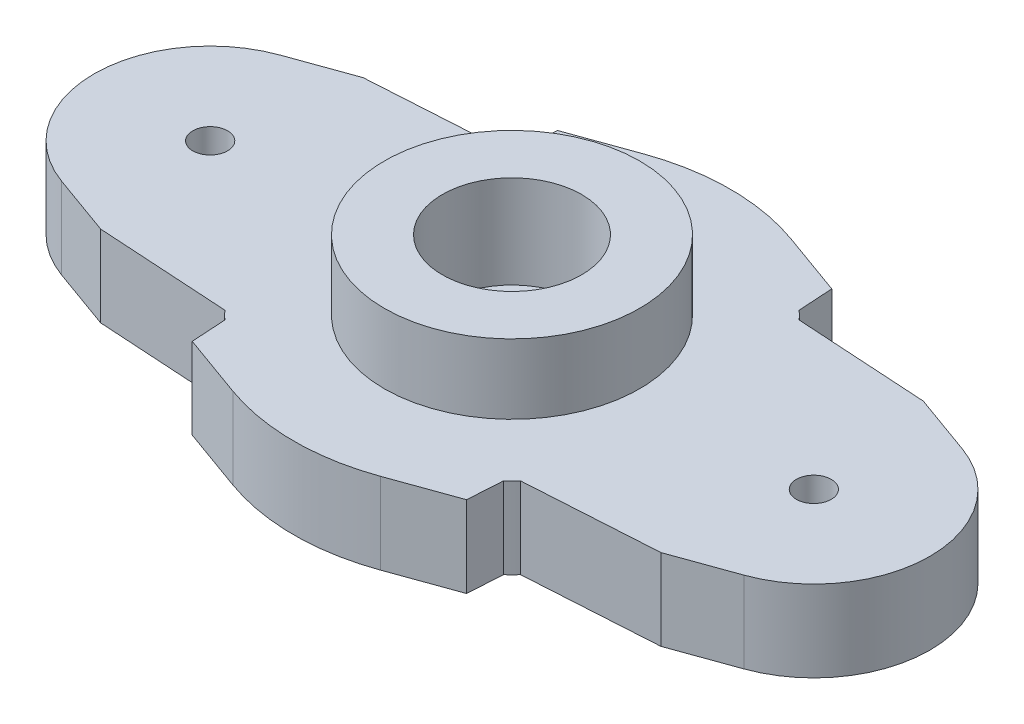
from build123d import *

# Parameters (mm, degrees)
SKETCH1_R           = 5.5
SKETCH1_R_2         = 3
BOSS_EXTRUDE1_DEPTH = 6.5
SKETCH2_R           = 3
BOSS_EXTRUDE2_DEPTH = 3.5
SKETCH4_R           = 3
SKETCH4_R_2         = 1.6
BOSS_EXTRUDE3_DEPTH = 2.5
SKETCH3_R           = 3.75
CUT_EXTRUDE2_DEPTH  = 2
CHAMFER1_SIZE2      = 2
CHAMFER1_SIZE       = 1
SKETCH5_R           = 0.75
CUT_EXTRUDE4_DEPTH  = 40.430318284
SKETCH6_OUTSIDE_W   = 72.61
SKETCH6_OUTSIDE_H   = 72.61
CUT_EXTRUDE5_DEPTH  = 40.430318284


with BuildPart() as part:
    # Sketch1 → Boss-Extrude1 (new body)
    with BuildSketch(Plane(origin=(0, 0, 0), x_dir=(1, 0, 0), z_dir=(0, 1, 0))):
        with Locations(Location((0, 0, 0), (0, 0, 90))):
            Circle(SKETCH1_R)
        with Locations(Location((0, 0, 0), (0, 0, 90))):
            Circle(SKETCH1_R_2, mode=Mode.SUBTRACT)
    extrude(amount=BOSS_EXTRUDE1_DEPTH)

    # Sketch2 → Boss-Extrude2 (add)
    with BuildSketch(Plane(origin=(0, 0, 0), x_dir=(1, 0, 0), z_dir=(0, 1, 0))):
        with BuildLine():
            Line((-6, 6.368869601), (-4.990599203, 22.806463037))
            ThreePointArc((-4.990599203, 22.806463037), (0, 27.5), (4.990599203, 22.806463037))
            Line((4.990599203, 22.806463037), (6, 6.368869601))
            ThreePointArc((6, 6.368869601), (6.187184335, 6.187184335), (6.368869601, 6))
            Line((6.368869601, 6), (22.806463037, 4.990599203))
            ThreePointArc((22.806463037, 4.990599203), (27.5, 0), (22.806463037, -4.990599203))
            Line((22.806463037, -4.990599203), (6.368869601, -6))
            ThreePointArc((6.368869601, -6), (6.187184335, -6.187184335), (6, -6.368869601))
            Line((6, -6.368869601), (4.990599203, -22.806463037))
            ThreePointArc((4.990599203, -22.806463037), (0, -27.5), (-4.990599203, -22.806463037))
            Line((-4.990599203, -22.806463037), (-6, -6.368869601))
            ThreePointArc((-6, -6.368869601), (-6.187184335, -6.187184335), (-6.368869601, -6))
            Line((-6.368869601, -6), (-22.806463037, -4.990599203))
            ThreePointArc((-22.806463037, -4.990599203), (-27.5, 0), (-22.806463037, 4.990599203))
            Line((-22.806463037, 4.990599203), (-6.368869601, 6))
            ThreePointArc((-6.368869601, 6), (-6.187184335, 6.187184335), (-6, 6.368869601))
        make_face()
        with Locations(Location((0, 0, 0), (0, 0, 90))):
            Circle(SKETCH2_R, mode=Mode.SUBTRACT)
    extrude(amount=BOSS_EXTRUDE2_DEPTH)

    # Sketch4 → Boss-Extrude3 (add)
    with BuildSketch(Plane(origin=(0, 0, 0), x_dir=(1, 0, 0), z_dir=(0, 1, 0))):
        with Locations(Location((0, 0, 0), (0, 0, 90))):
            Circle(SKETCH4_R)
        with Locations(Location((0, 0, 0), (0, 0, 270))):
            Circle(SKETCH4_R_2, mode=Mode.SUBTRACT)
    extrude(amount=BOSS_EXTRUDE3_DEPTH)

    # Sketch3 → Cut-Extrude2 (cut)
    with BuildSketch(Plane(origin=(0, 0, 0), x_dir=(1, 0, 0), z_dir=(0, 1, 0))):
        with Locations(Location((0, 0, 0), (0, 0, 270))):
            Circle(SKETCH3_R)
    extrude(amount=CUT_EXTRUDE2_DEPTH, mode=Mode.SUBTRACT)

    # Chamfer1
    chamfer1_edges = [part.edges().sort_by_distance(p)[0] for p in [
        (0, 0, -3.75),
    ]]
    chamfer1_side = [part.faces().sort_by_distance(p)[0] for p in [
        (0, 0, -3.77),
    ]]
    chamfer(chamfer1_edges, length=CHAMFER1_SIZE - 0.0001, length2=CHAMFER1_SIZE2 - 0.0001, reference=chamfer1_side[0])  # a hair under: the kernel refuses the full size

    # Sketch5 → Cut-Extrude4 (cut, through all)
    with BuildSketch(Plane(origin=(0, 0, 0), x_dir=(1, 0, 0), z_dir=(0, 1, 0))):
        with Locations(Location((0, 15, 0), (0, 0, 90))):
            Circle(SKETCH5_R)
        with Locations(Location((0, 21, 0), (0, 0, 90))):
            Circle(SKETCH5_R)
        with Locations(Location((13, 0, 0), (0, 0, 90))):
            Circle(SKETCH5_R)
        with Locations(Location((19, 0, 0), (0, 0, 90))):
            Circle(SKETCH5_R)
        with Locations(Location((25, 0, 0), (0, 0, 90))):
            Circle(SKETCH5_R)
        with Locations(Location((0, -21, 0), (0, 0, 90))):
            Circle(SKETCH5_R)
        with Locations(Location((0, -15, 0), (0, 0, 90))):
            Circle(SKETCH5_R)
        with Locations(Location((-13, 0, 0), (0, 0, 90))):
            Circle(SKETCH5_R)
        with Locations(Location((-19, 0, 0), (0, 0, 90))):
            Circle(SKETCH5_R)
        with Locations(Location((-25, 0, 0), (0, 0, 90))):
            Circle(SKETCH5_R)
    extrude(amount=CUT_EXTRUDE4_DEPTH, mode=Mode.SUBTRACT)

    # Sketch6 outside → Cut-Extrude5 (cut, through all)
    with BuildSketch(Plane.XZ):
        Rectangle(SKETCH6_OUTSIDE_W, SKETCH6_OUTSIDE_H)
        with BuildLine():
            Line((3.181538462, -8.845214131), (14.692307692, -4.704901133))
            ThreePointArc((14.692307692, -4.704901133), (18, 0), (14.692307692, 4.704901133))
            Line((14.692307692, 4.704901133), (3.181538462, 8.845214131))
            ThreePointArc((3.181538462, 8.845214131), (0, 9.4), (-3.181538462, 8.845214131))
            Line((-3.181538462, 8.845214131), (-14.692307692, 4.704901133))
            ThreePointArc((-14.692307692, 4.704901133), (-18, 0), (-14.692307692, -4.704901133))
            Line((-14.692307692, -4.704901133), (-3.181538462, -8.845214131))
            ThreePointArc((-3.181538462, -8.845214131), (0, -9.4), (3.181538462, -8.845214131))
        make_face(mode=Mode.SUBTRACT)
    extrude(amount=-CUT_EXTRUDE5_DEPTH, mode=Mode.SUBTRACT)


solid = part.part
